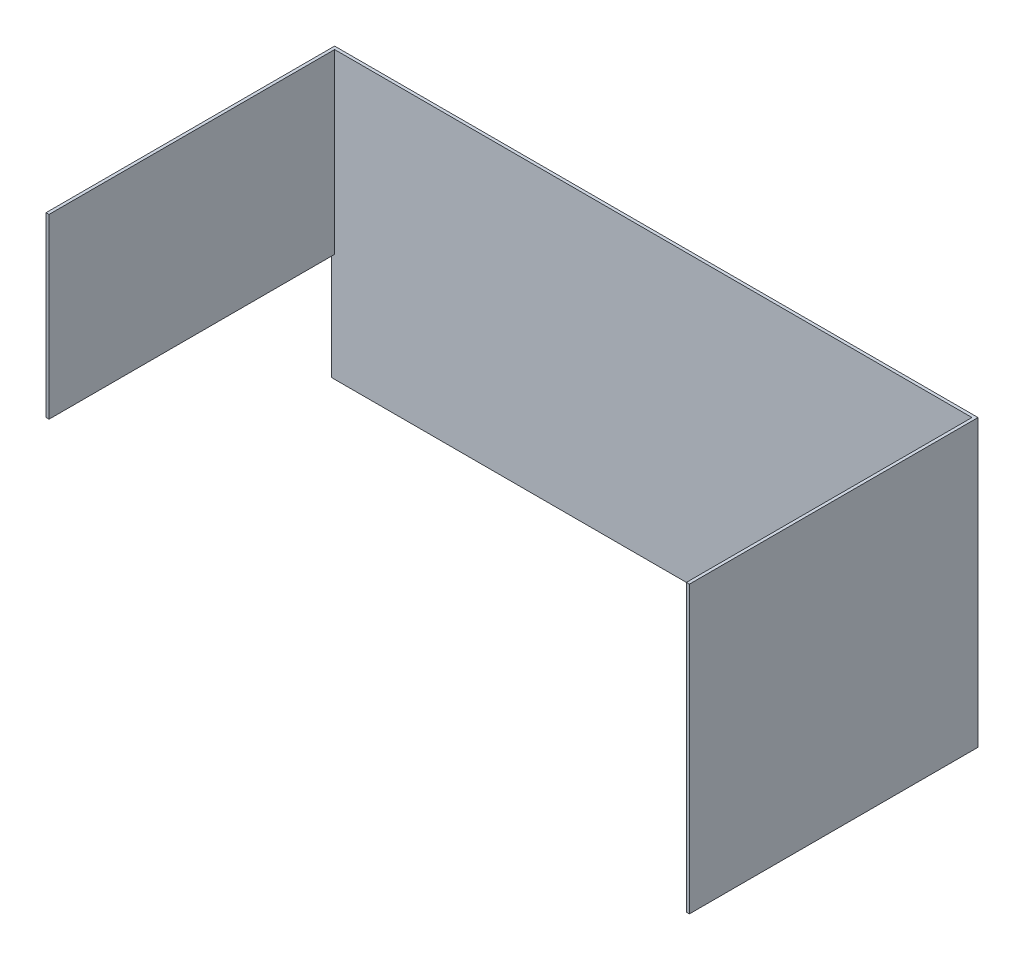
from build123d import *

# Parameters (mm, degrees)
EXTRUDE_THIN1_DEPTH = 301.625
CUT_EXTRUDE1_REACH  = 758.01
SKETCH2_W           = 301.625
SKETCH2_H           = 114.3


with BuildPart() as part:
    # Sketch1 → Extrude-Thin1 (new body)
    with BuildSketch(Plane(origin=(0, 0, 0), x_dir=(1, 0, 0), z_dir=(0, 1, 0))):
        Polygon((-339.725, -152.4), (-339.725, 152.4), (339.725, 152.4), (339.725, -152.4), (336.55, -152.4), (336.55, 149.225), (-336.55, 149.225), (-336.55, -152.4), align=None)
    extrude(amount=EXTRUDE_THIN1_DEPTH)

    # Sketch2 → Cut-Extrude1 (cut, up to next)
    with BuildSketch(Plane(origin=(-336.55, 0, 0), x_dir=(0, 0, -1), z_dir=(1, 0, 0)), mode=Mode.PRIVATE) as cut_extrude1_sk1:
        with Locations((-1.5875, 57.15)):
            Rectangle(SKETCH2_W, SKETCH2_H)
    cut_extrude1_tool1 = extrude(cut_extrude1_sk1.sketch, amount=-CUT_EXTRUDE1_REACH, mode=Mode.PRIVATE) & part.part
    add(cut_extrude1_tool1.solids().sort_by_distance((-336.55, 57.15, 1.5875))[0], mode=Mode.SUBTRACT)


solid = part.part
